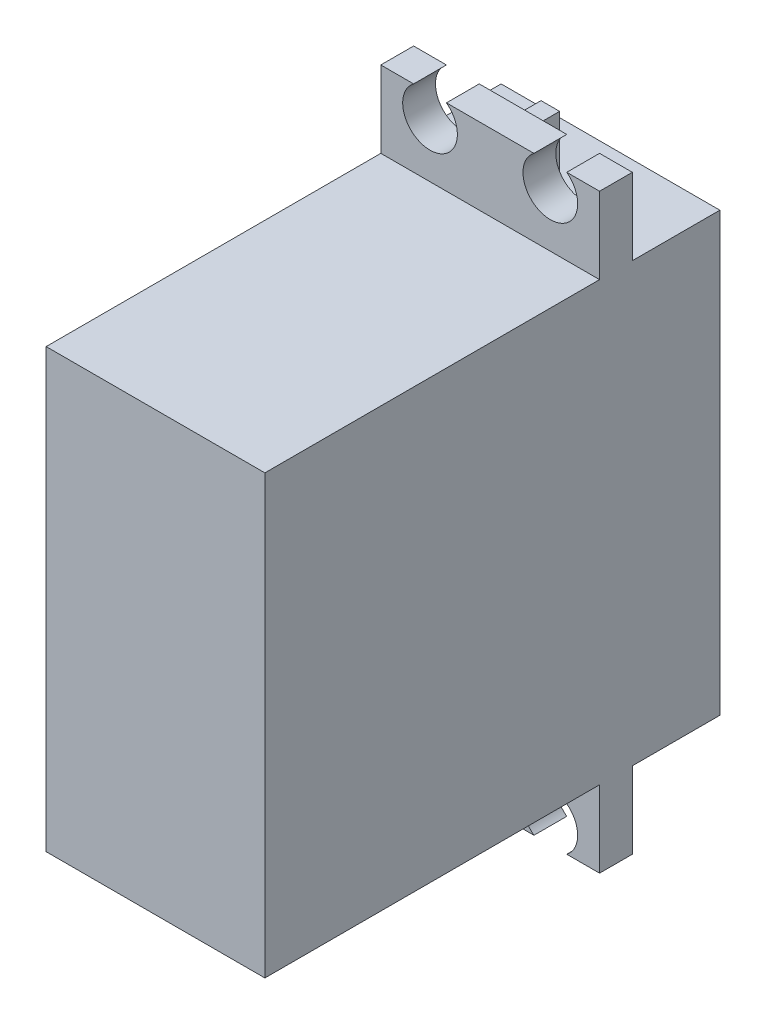
from build123d import *

# Parameters (mm, degrees)
SKETCH1_W           = 20
SKETCH1_H           = 40
BOSS_EXTRUDE1_DEPTH = 41.6
SKETCH2_R           = 3
SKETCH2_R_2         = 1.5
BOSS_EXTRUDE2_DEPTH = 4
BOSS_EXTRUDE3_START = -11
BOSS_EXTRUDE3_DEPTH = 3
SKETCH5_W           = 1.7
SKETCH5_H           = 6
BOSS_EXTRUDE4_DEPTH = 2.5


with BuildPart() as part:
    # Sketch1 → Boss-Extrude1 (new body)
    with BuildSketch(Plane.XY):
        Rectangle(SKETCH1_W, SKETCH1_H)
    extrude(amount=BOSS_EXTRUDE1_DEPTH)

    # Sketch2 → Boss-Extrude2 (add)
    with BuildSketch(Plane(origin=(0, 0, 0), x_dir=(-1, 0, 0), z_dir=(0, 0, -1))):
        with Locations((0, 10)):
            Circle(SKETCH2_R)
        with Locations((0, 10)):
            Circle(SKETCH2_R_2, mode=Mode.SUBTRACT)
    extrude(amount=BOSS_EXTRUDE2_DEPTH)

    # Sketch3 → Boss-Extrude3 (add)
    with BuildSketch(Plane(origin=(0, 0, 0), x_dir=(-1, 0, 0), z_dir=(0, 0, -1)).offset(BOSS_EXTRUDE3_START)):
        with BuildLine():
            Line((10, -20), (-10, -20))
            Line((-10, -20), (-10, -27))
            Line((-10, -27), (-7, -27))
            ThreePointArc((-7, -27), (-5.5, -22.5), (-4, -27))
            Line((-4, -27), (4, -27))
            ThreePointArc((4, -27), (5.5, -22.5), (7, -27))
            Line((7, -27), (10, -27))
            Line((10, -27), (10, -20))
        make_face()
        with BuildLine():
            Line((-10, 27), (-10, 20))
            Line((-10, 20), (10, 20))
            Line((10, 20), (10, 27))
            Line((10, 27), (7, 27))
            ThreePointArc((7, 27), (5.5, 22.5), (4, 27))
            Line((4, 27), (-4, 27))
            ThreePointArc((-4, 27), (-5.5, 22.5), (-7, 27))
            Line((-7, 27), (-10, 27))
        make_face()
    extrude(amount=BOSS_EXTRUDE3_DEPTH)

    # Sketch5 → Boss-Extrude4 (add)
    with BuildSketch(Plane(origin=(0, 0, 8), x_dir=(-1, 0, 0), z_dir=(0, 0, -1))):
        with Locations((0, 23)):
            Rectangle(SKETCH5_W, SKETCH5_H)
        with Locations((0, -23)):
            Rectangle(SKETCH5_W, SKETCH5_H)
    extrude(amount=BOSS_EXTRUDE4_DEPTH)


solid = part.part
